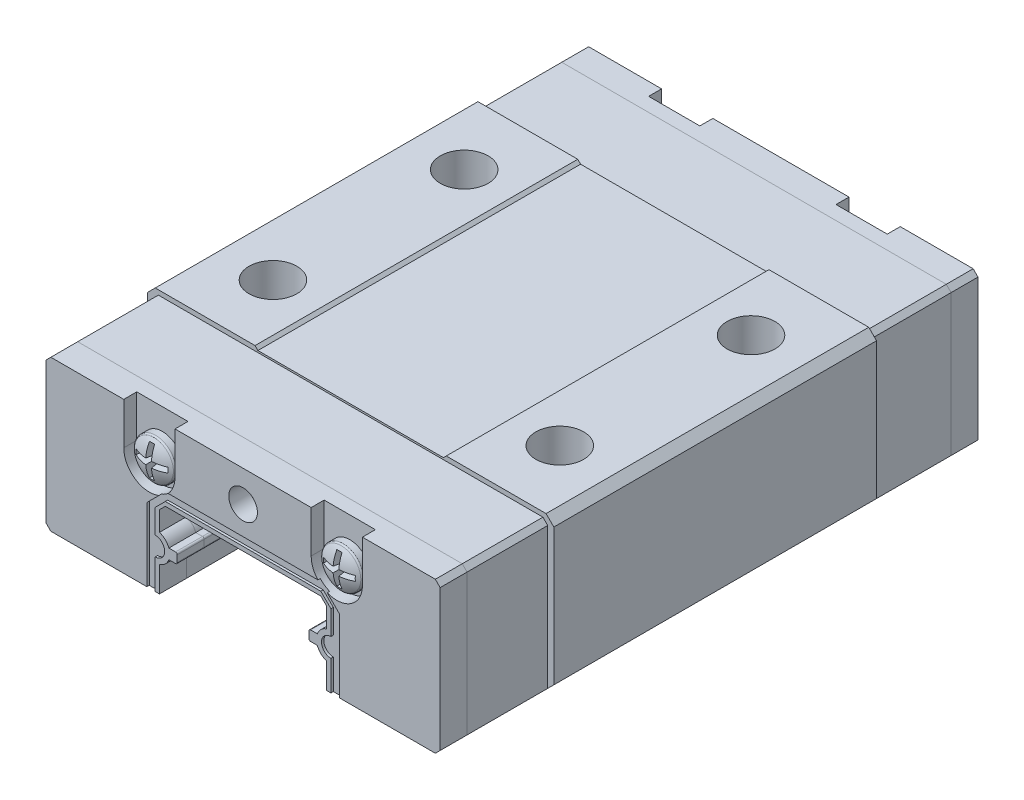
from build123d import *

# Parameters (mm, degrees)
EXTRUDE_1_DEPTH           = 6.75
EXTRUDE_1_DEPTH_BACK      = 6.75
CHAMFER_1_SIZE            = 0.325
EXTRUDE_START             = 6.75
EXTRUDE_2_DEPTH           = 3.375
EXTRUDE_START_2           = 11.25
EXTRUDE_5_DEPTH           = 1.125
SKETCH_13_R               = 0.6
CUT_EXTRUDE_4_DEPTH       = 0.84375
SKETCH_20_R               = 1.07185
CUT_EXTRUDE_8_DEPTH       = 0.64311
SKETCH_1_R                = 0.85748
EXTRUDE_8086_DEPTH        = 0.42874
CUT_EXTRUDE_START         = 0.771732
CUT_EXTRUDE_8355_DEPTH    = 0.514488
CUT_EXTRUDE_8355_DRAFT    = -5
FILLET_8681_R             = 0.085748
SKETCH_21_R               = 1.07185
EXTRUDE_6_DEPTH           = 0.1
CUT_EXTRUDE_4_2_DEPTH     = 0.54311
CUT_EXTRUDE_1_DEPTH       = 20.981632191
CHAMFER_2_SIZE            = 0.12
CUT_EXTRUDE_11_DEPTH      = 16.550518144
CUT_EXTRUDE_11_DEPTH_BACK = 16.550518144
CUT_EXTRUDE_20_DEPTH      = 0.1
SKETCH_30_W               = 0.1
SKETCH_30_H               = 0.1
CUT_EXTRUDE_16_DEPTH      = 0.01
SKETCH_52_W               = 0.1
SKETCH_52_H               = 0.1
EXTRUDE_14_DEPTH          = 0.01
EXTRUDE_10_DEPTH          = 13.5
SKETCH_47_R               = 0.204
CUT_EXTRUDE_22_DEPTH      = 13.5


# Read off the part's stored shape, not the designer's step: 圆顶-螺钉
with BuildPart() as part:
    # 草图3 → 凸台-拉伸1 (new, two sides: drawn at the far end of the back side and taken through both)
    with BuildSketch(Plane.XY.offset(-EXTRUDE_1_DEPTH_BACK)):
        Polygon((-8.5, 4.5), (-8.5, 6.5), (8.5, 6.5), (8.5, 4.5), (8.368675, 4.368675), (8.368675, 0.325), (8.043675, 0), (-8.043675, 0), (-8.368675, 0.325), (-8.368675, 4.368675), align=None)
    extrude(amount=EXTRUDE_1_DEPTH + EXTRUDE_1_DEPTH_BACK)

    # 倒角1
    chamfer_1_edges = [part.edges().sort_by_distance(p)[0] for p in [
        (-8.5, 6.5, 0),
        (8.5, 6.5, 0),
    ]]
    chamfer(chamfer_1_edges, length=CHAMFER_1_SIZE)

    # 草图5 → 切除-旋转1 (revolve, cut)
    with BuildSketch(Plane.XY.offset(-4), mode=Mode.PRIVATE) as cut_revolve_1_sk:
        Polygon((-6, 6.5), (-6, 3.038119785), (-6.8, 3.5), (-6.8, 4), (-7, 4), (-7, 6.5), align=None)
    cut_revolve_1 = revolve(cut_revolve_1_sk.sketch.rotate(Axis((-6, 6.5, -4), (0, -1, 0)), 270), axis=Axis((-6, 6.5, -4), (0, -1, 0)), mode=Mode.SUBTRACT)

    # 镜向1: 切除-旋转1 across plane
    add(cut_revolve_1.mirror(Plane.XY), mode=Mode.SUBTRACT)

    # 镜向2: 切除-旋转1 across plane
    add(cut_revolve_1.mirror(Plane(origin=(0, 0, 0), x_dir=(0, 0, 1), z_dir=(1, 0, 0))), mode=Mode.SUBTRACT)

    # 镜向2 copy 1 sketch → 镜向2 copy 1 (revolve, cut)
    with BuildSketch(Plane(origin=(0, 0, 4), x_dir=(-1, 0, 0), z_dir=(0, 0, -1))):
        Polygon((-6, 6.5), (-6, 3.038119785), (-6.8, 3.5), (-6.8, 4), (-7, 4), (-7, 6.5), align=None)
    revolve(axis=Axis((6, 6.5, 4), (0, -1, 0)), mode=Mode.SUBTRACT)

    # 草图4 → 切除-拉伸1 (cut, through all)
    with BuildSketch(Plane.XY.offset(6.75)):
        Polygon((-4, 6.5), (-1.333333333, 6.5), (1.333333333, 6.5), (4, 6.5), (4, 6.38), (1.333333333, 6.38), (-1.333333333, 6.38), (-4, 6.38), align=None)
    extrude(amount=-CUT_EXTRUDE_1_DEPTH, mode=Mode.SUBTRACT)

    # 倒角2
    chamfer_2_edges = [part.edges().sort_by_distance(p)[0] for p in [
        (4, 6.38, 0),
        (-4, 6.38, 0),
    ]]
    chamfer(chamfer_2_edges, length=CHAMFER_2_SIZE - 0.0001)  # a hair under: the kernel refuses the full size


with BuildPart() as body_2:
    # 草图6 → 凸台-拉伸2 (new body)
    with BuildSketch(Plane.XY.offset(EXTRUDE_START)):
        Polygon((-8.245, 0.201325), (-8.245, 6.103675), (-8.043675, 6.305), (8.043675, 6.305), (8.245, 6.103675), (8.245, 0.201325), (8.043675, 0), (-8.043675, 0), align=None)
    extrude(amount=EXTRUDE_2_DEPTH)


with BuildPart() as body_3:
    # 镜向3: mirrored copy
    add(body_2.part.mirror(Plane.XY))


with BuildPart() as body_4:
    # 草图12 → 凸台-拉伸5 (new body)
    with BuildSketch(Plane.XY.offset(EXTRUDE_START_2)):
        Polygon((-8.245, 0.201325), (-8.245, 6.103675), (-8.043675, 6.305), (8.043675, 6.305), (8.245, 6.103675), (8.245, 0.201325), (8.043675, 0), (-8.043675, 0), align=None)
    extrude(amount=-EXTRUDE_5_DEPTH)

    # 草图13 → Cut-Extrude 4 (cut)
    with BuildSketch(Plane(origin=(0, 0, 11.25), x_dir=(-1, 0, 0), z_dir=(0, 0, -1))):
        with Locations((0, 5)):
            Circle(SKETCH_13_R)
    extrude(amount=CUT_EXTRUDE_4_DEPTH, mode=Mode.SUBTRACT)

    # 草图20 → 切除-拉伸8 (cut)
    with BuildSketch(Plane(origin=(0, 0, 11.25), x_dir=(-1, 0, 0), z_dir=(0, 0, -1))):
        with Locations((-3.92, 4.55)):
            Circle(SKETCH_20_R)
    cut_extrude_8 = extrude(amount=CUT_EXTRUDE_8_DEPTH, mode=Mode.SUBTRACT)

    # 镜向11: 切除-拉伸8 across plane
    add(cut_extrude_8.mirror(Plane(origin=(0, 0, 0), x_dir=(0, 0, 1), z_dir=(1, 0, 0))), mode=Mode.SUBTRACT)



with BuildPart() as body_5:
    # Sketch 1 → Extrude 8086 (new body)
    with BuildSketch(Plane(origin=(-19.819348295, 5.999602039, 10.60689), x_dir=(1, 0, 0), z_dir=(0, 0, 1))):
        with Locations(Location((23.739348295, -1.449602039, 0), (0, 0, 180))):
            Circle(SKETCH_1_R)
    extrude(amount=EXTRUDE_8086_DEPTH)

    # Dome 8123 outline → Dome 8123 (revolve)
    with BuildSketch(Plane(origin=(3.92, 4.55, 0), x_dir=(1, 0, 0), z_dir=(0, -1, 0))):
        with BuildLine():
            Line((0, 11.03563), (0.857480001, 11.035629999))
            ThreePointArc((0.857480001, 11.035629999), (0.447617702, 11.227177671), (0, 11.292874))
            Line((0, 11.292874), (0, 11.03563))
        make_face()
    revolve(axis=Axis((3.92, 4.55, 0), (0, 0, 1)))


with BuildPart() as cut_extrude_8355_tool:
    # Sketch 2 → Cut-Extrude 8355 (with draft: the straight prism first)
    with BuildSketch(Plane(origin=(-19.819348295, 5.999602039, 10.60689), x_dir=(1, 0, 0), z_dir=(0, 0, 1)).offset(CUT_EXTRUDE_START)):
        Polygon((23.867970295, -1.578224039), (24.425332295, -1.578224039), (24.425332295, -1.320980039), (23.867970295, -1.320980039), (23.867970295, -0.763618039), (23.610726295, -0.763618039), (23.610726295, -1.320980039), (23.053364295, -1.320980039), (23.053364295, -1.578224039), (23.610726295, -1.578224039), (23.610726295, -2.135586039), (23.867970295, -2.135586039), align=None)
    extrude(amount=-CUT_EXTRUDE_8355_DEPTH)
    # Cut-Extrude 8355: the draft: its side faces are tilted about the plane it starts from
    cut_extrude_8355_sides = [cut_extrude_8355_tool.faces().sort_by_distance(p)[0] for p in [
        (4.327303, 4.421378, 11.121378),
        (4.605984, 4.55, 11.121378),
        (4.327303, 4.678622, 11.121378),
        (4.048622, 4.957303, 11.121378),
        (3.92, 5.235984, 11.121378),
        (3.791378, 4.957303, 11.121378),
        (3.512697, 4.678622, 11.121378),
        (3.234016, 4.55, 11.121378),
        (3.512697, 4.421378, 11.121378),
        (3.791378, 4.142697, 11.121378),
        (3.92, 3.864016, 11.121378),
        (4.048622, 4.142697, 11.121378),
    ]]
    draft(cut_extrude_8355_sides, Plane(origin=(-19.819348295, 5.999602039, 10.60689), x_dir=(1, 0, 0), z_dir=(0, 0, 1)).offset(CUT_EXTRUDE_START), CUT_EXTRUDE_8355_DRAFT)


with BuildPart() as body_5_1:
    add(body_5.part)

    # Cut-Extrude 8355: cut by cut_extrude_8355_tool
    add(cut_extrude_8355_tool.part, mode=Mode.SUBTRACT)

    # Fillet 8681
    fillet_8681_edges = [body_5_1.edges().sort_by_distance(p)[0] for p in [
        (3.92, 5.40748, 11.03563),
    ]]
    fillet(fillet_8681_edges, radius=FILLET_8681_R)


with BuildPart() as body_6:
    # 镜向12: mirrored copy
    add(body_5_1.part.mirror(Plane(origin=(0, 0, 0), x_dir=(0, 0, 1), z_dir=(1, 0, 0))))


with BuildPart() as body_4_1:
    add(body_4.part)

    add(body_5_1.part)  # 凸台-拉伸6 merges body 5

    add(body_6.part)  # 凸台-拉伸6 merges body 6
    # 草图21 → 凸台-拉伸6 (add)
    with BuildSketch(Plane.XY.offset(10.60689)):
        with Locations((3.92, 4.55)):
            Circle(SKETCH_21_R)
        with Locations((-3.92, 4.55)):
            Circle(SKETCH_21_R)
    extrude(amount=EXTRUDE_6_DEPTH)

    # 草图31 → Cut-Extrude 4 2 (cut)
    with BuildSketch(Plane(origin=(0, 0, 11.25), x_dir=(-1, 0, 0), z_dir=(0, 0, -1))):
        with BuildLine():
            Line((4.99185, 6.5), (2.84815, 6.5))
            Line((2.84815, 6.5), (2.84815, 4.55))
            ThreePointArc((2.84815, 4.55), (3.92, 5.62185), (4.99185, 4.55))
            Line((4.99185, 4.55), (4.99185, 6.5))
        make_face()
        with BuildLine():
            Line((-2.84815, 6.5), (-2.84815, 4.55))
            ThreePointArc((-2.84815, 4.55), (-3.92, 5.62185), (-4.99185, 4.55))
            Line((-4.99185, 4.55), (-4.99185, 6.5))
            Line((-4.99185, 6.5), (-2.84815, 6.5))
        make_face()
    extrude(amount=CUT_EXTRUDE_4_2_DEPTH, mode=Mode.SUBTRACT)


with BuildPart() as cut_extrude_11_tool:
    # 草图23 → 切除-拉伸11 (new, two sides: drawn at the far end of the back side and taken through both)
    with BuildSketch(Plane.XY.offset(-CUT_EXTRUDE_11_DEPTH_BACK)):
        with BuildLine():
            Line((-3.2525, -1.5), (3.2525, -1.5))
            Line((3.2525, -1.5), (3.5, -1.2525))
            Line((3.5, -1.2525), (3.5, 1.06875))
            ThreePointArc((3.5, 1.06875), (3.259017021, 1.207920003), (3.105459341, 1.44))
            Line((3.105459341, 1.44), (2.825459341, 1.44))
            ThreePointArc((2.825459341, 1.44), (2.775961866, 1.460502525), (2.755459341, 1.51))
            Line((2.755459341, 1.51), (2.755459341, 1.79))
            ThreePointArc((2.755459341, 1.79), (2.775961866, 1.839497475), (2.825459341, 1.86))
            Line((2.825459341, 1.86), (3.105459341, 1.86))
            ThreePointArc((3.105459341, 1.86), (3.259017021, 2.092079997), (3.5, 2.23125))
            Line((3.5, 2.23125), (3.5, 3.0525))
            Line((3.5, 3.0525), (3.2525, 3.3))
            Line((3.2525, 3.3), (-3.2525, 3.3))
            Line((-3.2525, 3.3), (-3.5, 3.0525))
            Line((-3.5, 3.0525), (-3.5, 2.23125))
            ThreePointArc((-3.5, 2.23125), (-3.259017021, 2.092079997), (-3.105459341, 1.86))
            Line((-3.105459341, 1.86), (-2.825459341, 1.86))
            ThreePointArc((-2.825459341, 1.86), (-2.775961866, 1.839497475), (-2.755459341, 1.79))
            Line((-2.755459341, 1.79), (-2.755459341, 1.51))
            ThreePointArc((-2.755459341, 1.51), (-2.775961866, 1.460502525), (-2.825459341, 1.44))
            Line((-2.825459341, 1.44), (-3.105459341, 1.44))
            ThreePointArc((-3.105459341, 1.44), (-3.259017021, 1.207920003), (-3.5, 1.06875))
            Line((-3.5, 1.06875), (-3.5, -1.2525))
            Line((-3.5, -1.2525), (-3.2525, -1.5))
        make_face()
    extrude(amount=CUT_EXTRUDE_11_DEPTH + CUT_EXTRUDE_11_DEPTH_BACK)


with BuildPart() as part_1:
    add(part.part)

    # 切除-拉伸11: cut by cut_extrude_11_tool
    add(cut_extrude_11_tool.part, mode=Mode.SUBTRACT)

    # 草图36 → 凸台-拉伸10 (add)
    with BuildSketch(Plane.XY.offset(6.75)):
        Polygon((8.368675, 4.368675), (8.368675, 0.325), (8.5, 0.456325), (8.5, 4.5), align=None)
        Polygon((-8.5, 4.5), (-8.368675, 4.368675), (-8.368675, 0.325), (-8.5, 0.456325), align=None)
    extrude(amount=-EXTRUDE_10_DEPTH)

    # 草图47 → 切除-拉伸22 (cut)
    with BuildSketch(Plane.XY.offset(6.75)):
        with Locations((-8.5, 3.3156625)):
            Circle(SKETCH_47_R)
    extrude(amount=-CUT_EXTRUDE_22_DEPTH, mode=Mode.SUBTRACT)


with BuildPart() as body_2_1:
    add(body_2.part)

    # 切除-拉伸11: cut by cut_extrude_11_tool
    add(cut_extrude_11_tool.part, mode=Mode.SUBTRACT)

    # 草图30 → 切除-拉伸16 (cut)
    with BuildSketch(Plane(origin=(-8.245, 38.533735384, -6.545685671), x_dir=(0, -1, 0), z_dir=(-1, 0, 0))):
        with Locations((32.480060384, 15.033185671)):
            Rectangle(SKETCH_30_W, SKETCH_30_H)
    extrude(amount=-CUT_EXTRUDE_16_DEPTH, mode=Mode.SUBTRACT)

    # 草图52 → 凸台-拉伸14 (add)
    with BuildSketch(Plane.ZY.offset(8.235)):
        with Locations((8.4875, 6.053675)):
            Rectangle(SKETCH_52_W, SKETCH_52_H)
    extrude(amount=EXTRUDE_14_DEPTH)


with BuildPart() as body_3_1:
    add(body_3.part)

    # 切除-拉伸11: cut by cut_extrude_11_tool
    add(cut_extrude_11_tool.part, mode=Mode.SUBTRACT)


with BuildPart() as body_4_2:
    add(body_4_1.part)

    # 切除-拉伸11: cut by cut_extrude_11_tool
    add(cut_extrude_11_tool.part, mode=Mode.SUBTRACT)

    # 草图24 → 切除-拉伸20 (cut)
    with BuildSketch(Plane(origin=(0, 0, 11.25), x_dir=(-1, 0, 0), z_dir=(0, 0, -1))):
        with BuildLine():
            Line((-3.675, 0), (-3.675, 1.255459341))
            ThreePointArc((-3.675, 1.255459341), (-3.280459341, 1.65), (-3.675, 2.044540659))
            Line((-3.675, 2.044540659), (-3.675, 3.0525))
            Line((-3.675, 3.0525), (-3.2525, 3.475))
            Line((-3.2525, 3.475), (3.2525, 3.475))
            Line((3.2525, 3.475), (3.675, 3.0525))
            Line((3.675, 3.0525), (3.675, 2.044540659))
            ThreePointArc((3.675, 2.044540659), (3.280459341, 1.65), (3.675, 1.255459341))
            Line((3.675, 1.255459341), (3.675, 0))
            Line((3.675, 0), (4.025, 0))
            Line((4.025, 0), (4.025, 3.0525))
            Line((4.025, 3.0525), (3.2525, 3.825))
            Line((3.2525, 3.825), (-3.2525, 3.825))
            Line((-3.2525, 3.825), (-4.025, 3.0525))
            Line((-4.025, 3.0525), (-4.025, 0))
            Line((-4.025, 0), (-3.675, 0))
        make_face()
    extrude(amount=CUT_EXTRUDE_20_DEPTH, mode=Mode.SUBTRACT)


with BuildPart() as body_5_2:
    # 镜向17: mirrored copy
    add(body_4_2.part.mirror(Plane(origin=(0, 0, 0), x_dir=(1, 0, 0), z_dir=(0, 0, -1))))


solid = Compound([part_1.part, body_2_1.part, body_3_1.part, body_4_2.part, body_5_2.part])
